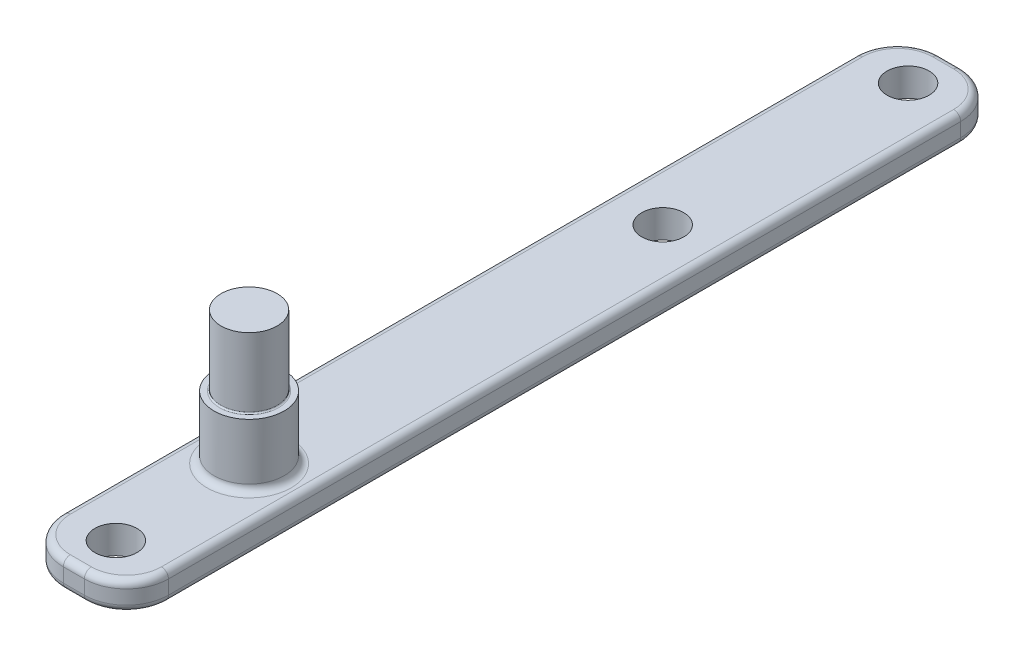
from build123d import *

# Parameters (mm, degrees)
SKETCH1_R           = 3
BOSS_EXTRUDE1_DEPTH = 4
SKETCH2_R           = 5
BOSS_EXTRUDE2_DEPTH = 9
SKETCH3_R           = 4
BOSS_EXTRUDE3_DEPTH = 10
FILLET1_R           = 1
FILLET2_R           = 6
FILLET3_R           = 1
FILLET4_R           = 0.2


with BuildPart() as part:
    # Sketch1 → Boss-Extrude1 (new body)
    with BuildSketch(Plane(origin=(0, 0, 0), x_dir=(1, 0, 0), z_dir=(0, 1, 0))):
        Polygon((-7.5, 45), (-7.5, -45), (7.5, -45), (7.5, 45), (7.5, 80), (-7.5, 80), align=None)
        with Locations((0, 39)):
            Circle(SKETCH1_R, mode=Mode.SUBTRACT)
        with Locations((0, -39)):
            Circle(SKETCH1_R, mode=Mode.SUBTRACT)
        with Locations((0, 74)):
            Circle(SKETCH1_R, mode=Mode.SUBTRACT)
    extrude(amount=BOSS_EXTRUDE1_DEPTH)

    # Sketch2 → Boss-Extrude2 (add)
    with BuildSketch(Plane(origin=(0, 4, 0), x_dir=(1, 0, 0), z_dir=(0, 1, 0))):
        with Locations((0, -20)):
            Circle(SKETCH2_R)
    extrude(amount=BOSS_EXTRUDE2_DEPTH)

    # Sketch3 → Boss-Extrude3 (add)
    with BuildSketch(Plane(origin=(0, 13, 0), x_dir=(1, 0, 0), z_dir=(0, 1, 0))):
        with Locations((0, -20)):
            Circle(SKETCH3_R)
    extrude(amount=BOSS_EXTRUDE3_DEPTH)

    # Fillet1
    fillet1_edges = [part.edges().sort_by_distance(p)[0] for p in [
        (-5, 4, 20),
    ]]
    fillet(fillet1_edges, radius=FILLET1_R)

    # Fillet2
    fillet2_edges = [part.edges().sort_by_distance(p)[0] for p in [
        (-7.5, 2, 45),
        (7.5, 2, 45),
        (-7.5, 2, -80),
        (7.5, 2, -80),
    ]]
    fillet(fillet2_edges, radius=FILLET2_R)

    # Fillet3
    fillet3_edges = [part.edges().sort_by_distance(p)[0] for p in [
        (5.742640687, 0, 43.242640687),
        (0, 0, 45),
        (-5.742640687, 0, 43.242640687),
        (-7.5, 0, -17.5),
        (5.742640687, 4, 43.242640687),
        (0, 4, 45),
        (-5.742640687, 4, 43.242640687),
        (-7.5, 4, -17.5),
        (7.5, 0, -17.5),
        (7.5, 4, -17.5),
        (-5.742640687, 0, -78.242640687),
        (0, 0, -80),
        (5.742640687, 0, -78.242640687),
        (-5.742640687, 4, -78.242640687),
        (0, 4, -80),
        (5.742640687, 4, -78.242640687),
    ]]
    fillet(fillet3_edges, radius=FILLET3_R)

    # Fillet4
    fillet4_edges = [part.edges().sort_by_distance(p)[0] for p in [
        (-4, 13, 20),
    ]]
    fillet(fillet4_edges, radius=FILLET4_R)


solid = part.part
